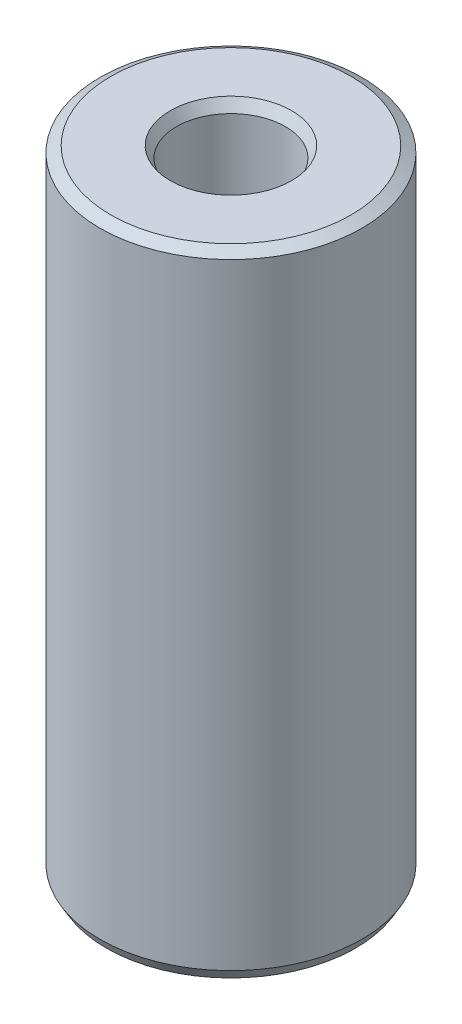
from build123d import *
from OCP.BRepFilletAPI import BRepFilletAPI_MakeChamfer

# Parameters (mm, degrees)
SKETCH1_R           = 57.5
BOSS_EXTRUDE1_DEPTH = 278.101247654
SKETCH2_R           = 23.950056964
CUT_EXTRUDE1_DEPTH  = 290.746102556
CHAMFER1_SIZE       = 2.723086751
CHAMFER1_SIZE2      = 4.716524607


with BuildPart() as part:
    # Sketch1 → Boss-Extrude1 (new body)
    with BuildSketch(Plane(origin=(0, 0, 0), x_dir=(1, 0, 0), z_dir=(0, 1, 0))):
        Circle(SKETCH1_R)
    extrude(amount=BOSS_EXTRUDE1_DEPTH)

    # Sketch2 → Cut-Extrude1 (cut, through all)
    with BuildSketch(Plane(origin=(0, 0, 0), x_dir=(1, 0, 0), z_dir=(0, 1, 0))):
        Circle(SKETCH2_R)
    extrude(amount=CUT_EXTRUDE1_DEPTH, mode=Mode.SUBTRACT)

    # Chamfer1: one chamfer whose edges measure the first distance from different faces: ONE call of the kernel's chamfer builder (chamfer() names one face for all edges)
    chamfer1_edges_1 = [part.edges().sort_by_distance(p)[0] for p in [
        (-23.950056964, 278.101247654, 0),
    ]]
    chamfer1_side_1 = [part.faces().sort_by_distance(p)[0] for p in [
        (-55.873654403, 278.101247654, 0),
    ]]
    chamfer1_edges_2 = [part.edges().sort_by_distance(p)[0] for p in [
        (-23.950056964, 0, 0),
    ]]
    chamfer1_side_2 = [part.faces().sort_by_distance(p)[0] for p in [
        (-23.950056964, 139.050623827, 0),
    ]]
    chamfer1_edges_3 = [part.edges().sort_by_distance(p)[0] for p in [
        (-57.5, 0, 0),
    ]]
    chamfer1_side_3 = [part.faces().sort_by_distance(p)[0] for p in [
        (-55.873654403, 0, 0),
    ]]
    chamfer1_edges_4 = [part.edges().sort_by_distance(p)[0] for p in [
        (-57.5, 278.101247654, 0),
    ]]
    chamfer1_side_4 = [part.faces().sort_by_distance(p)[0] for p in [
        (-57.5, 139.050623827, 0),
    ]]
    chamfer1 = BRepFilletAPI_MakeChamfer(part.part.solid().wrapped)
    for e in chamfer1_edges_1:
        chamfer1.Add(CHAMFER1_SIZE, CHAMFER1_SIZE2, e.wrapped, chamfer1_side_1[0].wrapped)  # the first distance lies on this face
    for e in chamfer1_edges_2:
        chamfer1.Add(CHAMFER1_SIZE, CHAMFER1_SIZE2, e.wrapped, chamfer1_side_2[0].wrapped)  # the first distance lies on this face
    for e in chamfer1_edges_3:
        chamfer1.Add(CHAMFER1_SIZE, CHAMFER1_SIZE2, e.wrapped, chamfer1_side_3[0].wrapped)  # the first distance lies on this face
    for e in chamfer1_edges_4:
        chamfer1.Add(CHAMFER1_SIZE, CHAMFER1_SIZE2, e.wrapped, chamfer1_side_4[0].wrapped)  # the first distance lies on this face
    add(Compound.cast(chamfer1.Shape()), mode=Mode.REPLACE)


solid = part.part
